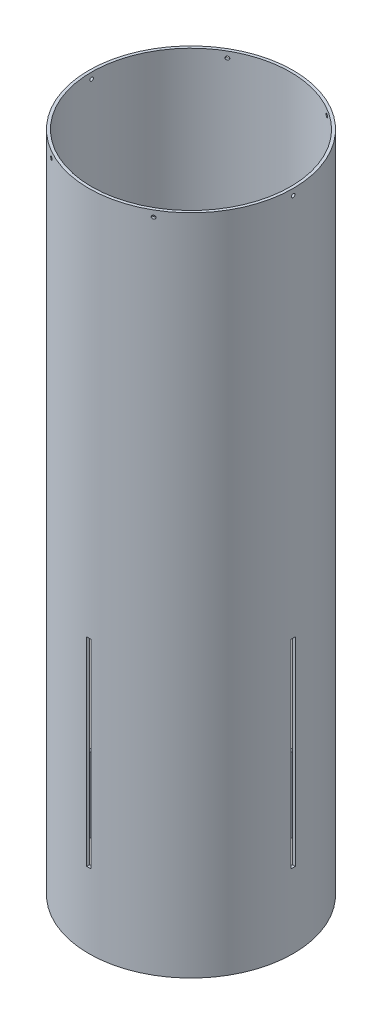
from build123d import *

# Parameters (mm, degrees)
SKETCH1_R           = 78.359
SKETCH1_R_2         = 76.2
BOSS_EXTRUDE1_DEPTH = 508
CUT_EXTRUDE1_DEPTH  = 520.946406625
CIRPATTERN1_COUNT   = 4
CUT_EXTRUDE2_DEPTH  = 520.946406625
CIRPATTERN2_COUNT   = 6
SKETCH3_R           = 3.175
CUT_EXTRUDE3_DEPTH  = 520.946406753


with BuildPart() as part:
    # Sketch1 → Boss-Extrude1 (new body)
    with BuildSketch(Plane(origin=(0, 0, 0), x_dir=(1, 0, 0), z_dir=(0, 1, 0))):
        Circle(SKETCH1_R)
        Circle(SKETCH1_R_2, mode=Mode.SUBTRACT)
    extrude(amount=BOSS_EXTRUDE1_DEPTH)

    # Sketch2 → Cut-Extrude1 (cut, through all)
    with BuildSketch(Plane(origin=(0, 0, 0), x_dir=(0, 0, -1), z_dir=(1, 0, 0))):
        Polygon((0, 57.15), (1.5875, 57.15), (1.5875, 209.55), (-1.5875, 209.55), (-1.5875, 57.15), align=None)
    cut_extrude1 = extrude(amount=-CUT_EXTRUDE1_DEPTH, mode=Mode.SUBTRACT)

    # CirPattern1: Cut-Extrude1 ×4 about axis
    cirpattern1_axis = Axis((0, 0, 0), (0, 1, 0))
    for i in range(1, CIRPATTERN1_COUNT):
        add(cut_extrude1.rotate(cirpattern1_axis, i * 360 / CIRPATTERN1_COUNT), mode=Mode.SUBTRACT)

    # Sketch2<3> → Cut-Extrude2 (cut, through all)
    with BuildSketch(Plane(origin=(0, 0, 0), x_dir=(0, 0, -1), z_dir=(1, 0, 0))):
        with BuildLine():
            ThreePointArc((0, 504.59005), (-0.956397277, 502.281102723), (1.35255, 503.2375))
            ThreePointArc((1.35255, 503.2375), (0.956397277, 504.193897277), (0, 504.59005))
        make_face()
    cut_extrude2 = extrude(amount=-CUT_EXTRUDE2_DEPTH, mode=Mode.SUBTRACT)

    # CirPattern2: Cut-Extrude2 ×6 about axis
    cirpattern2_axis = Axis((0, 508, 0), (0, -1, 0))
    for i in range(1, CIRPATTERN2_COUNT):
        add(cut_extrude2.rotate(cirpattern2_axis, i * 360 / CIRPATTERN2_COUNT), mode=Mode.SUBTRACT)

    # Sketch3 → Cut-Extrude3 (cut, through all)
    with BuildSketch(Plane(origin=(0, 0, 0), x_dir=(0.7071067811865477, 0, -0.7071067811865475), z_dir=(0.7071067811865475, 0, 0.7071067811865477))):
        with Locations((0, 127)):
            Circle(SKETCH3_R)
    extrude(amount=-CUT_EXTRUDE3_DEPTH, mode=Mode.SUBTRACT)


solid = part.part
